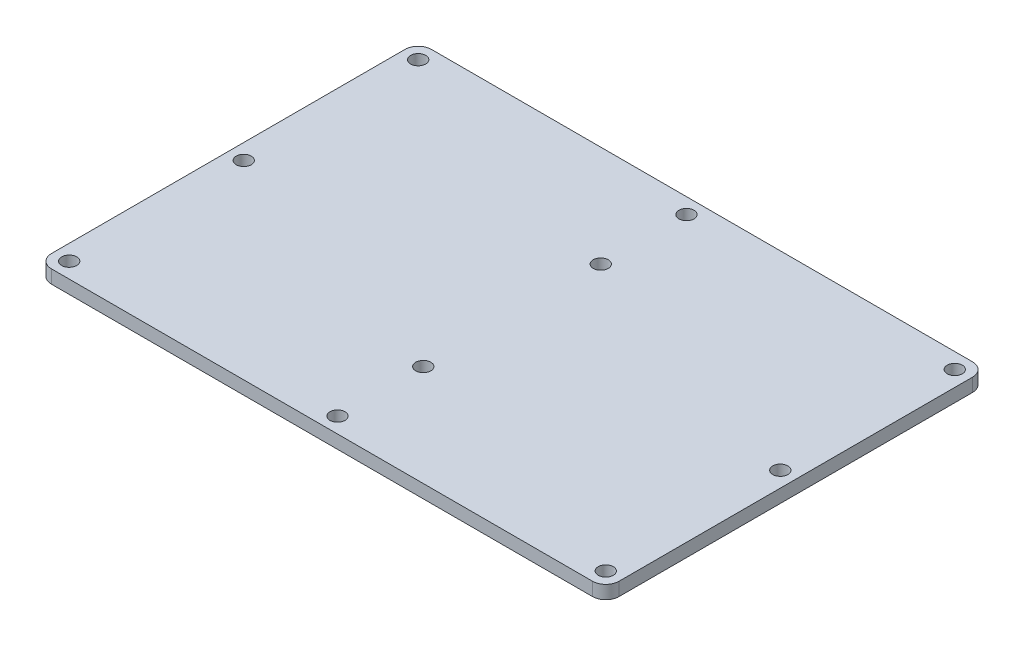
from build123d import *

# Parameters (mm, degrees)
SKETCH1_W            = 128
SKETCH1_H            = 85.7
BOSS_EXTRUDE1_DEPTH  = 3
M3_CLEARANCE_HOLE1_D = 3.4
FILLET1_R            = 3


with BuildPart() as part:
    # Sketch1 → Boss-Extrude1 (new body)
    with BuildSketch(Plane(origin=(0, 0, 0), x_dir=(1, 0, 0), z_dir=(0, 1, 0))):
        Rectangle(SKETCH1_W, SKETCH1_H)
    extrude(amount=BOSS_EXTRUDE1_DEPTH)

    # M3 Clearance Hole1 (through all)
    with Locations(Plane(origin=(0, 3, 0), x_dir=(1, 0, 0), z_dir=(0, 1, 0))):
        with Locations((-60.5, 39.35), (0, 39.35), (60.5, 39.35), (60.5, 0), (60.5, -39.35), (0, -39.35), (-60.5, -39.35), (-60.5, 0), (0, -20.01), (0, 20.01)):
            Hole(M3_CLEARANCE_HOLE1_D / 2)

    # Fillet1
    fillet1_edges = [part.edges().sort_by_distance(p)[0] for p in [
        (64, 1.5, -42.85),
        (64, 1.5, 42.85),
        (-64, 1.5, -42.85),
        (-64, 1.5, 42.85),
    ]]
    fillet(fillet1_edges, radius=FILLET1_R)


solid = part.part
